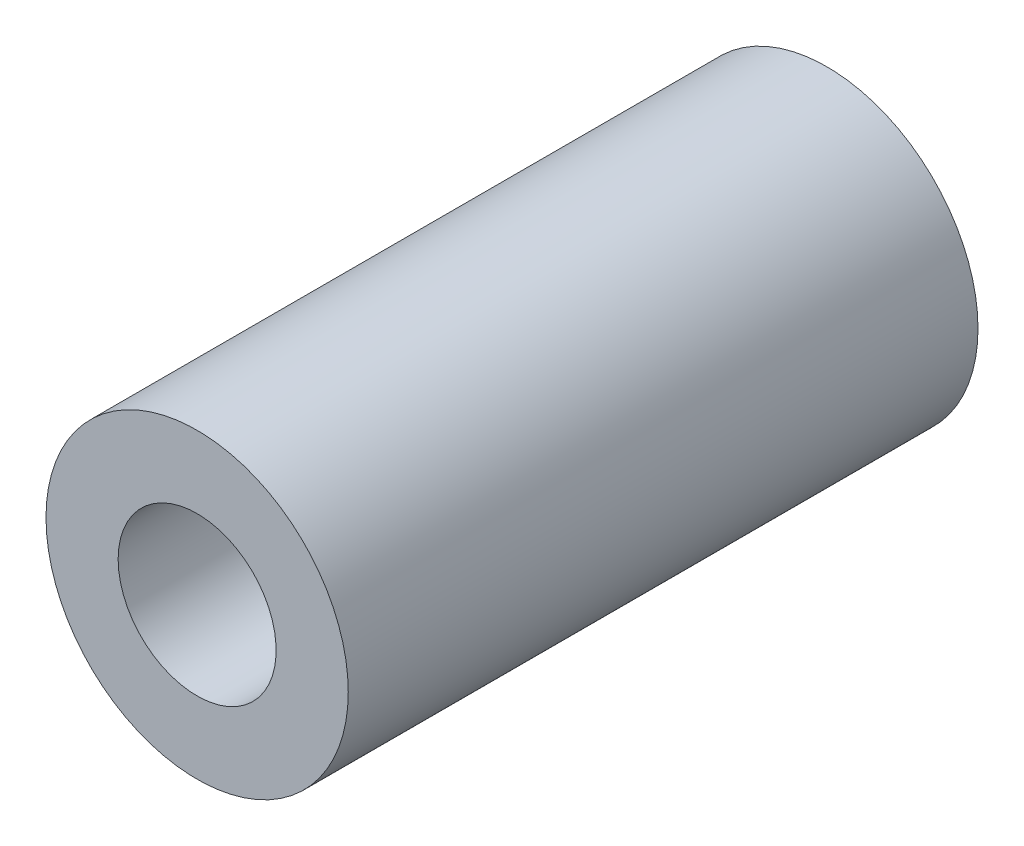
from build123d import *

# Parameters (mm, degrees)
SKETCH1_R           = 4.7625
SKETCH1_R_2         = 2.4892
BOSS_EXTRUDE1_DEPTH = 9.921875


with BuildPart() as part:
    # Sketch1 → Boss-Extrude1 (new, symmetric)
    with BuildSketch(Plane.XY):
        Circle(SKETCH1_R)
        Circle(SKETCH1_R_2, mode=Mode.SUBTRACT)
    extrude(amount=BOSS_EXTRUDE1_DEPTH, both=True)


solid = part.part
